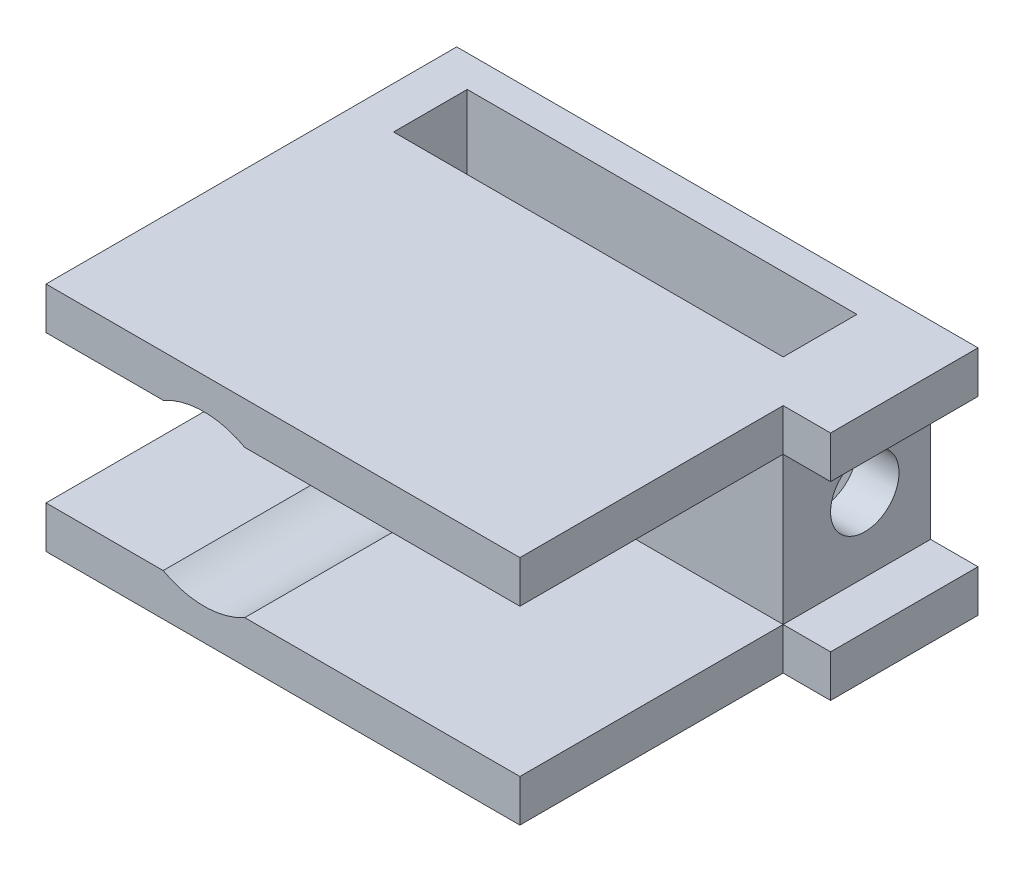
from build123d import *

# Parameters (mm, degrees)
ESQUISSE1_W                         = 45
ESQUISSE1_H                         = 22
BOSS_EXTRU_1_DEPTH                  = 4
ESQUISSE2_R                         = 6.4
ENL_V_MAT_EXTRU_1_DEPTH             = 4
FILETAGE1_PITCH                     = 1.4
ESQUISSE3_W                         = 4
ESQUISSE3_H                         = 22
BOSS_EXTRU_2_DEPTH                  = 10
ESQUISSE4_W                         = 3
ESQUISSE4_H                         = 22
BOSS_EXTRU_3_DEPTH                  = 37
ENL_V_MAT_EXTRU_2_REACH             = 49.592
ESQUISSE5_R                         = 3.25
ENL_V_MAT_EXTRU_2_DIRECTION_2_REACH = 49.592
ESQUISSE6_W                         = 45
ESQUISSE6_H                         = 4
BOSS_EXTRU_4_DEPTH                  = 25
ESQUISSE7_R                         = 8
ENL_V_MAT_EXTRU_4_DEPTH             = 25
ESQUISSE8_W                         = 14
ESQUISSE8_H                         = 4
BOSS_EXTRU_5_DEPTH                  = 4.5


with BuildPart() as part:
    # Esquisse1 → Boss.-Extru.1 (new body)
    with BuildSketch(Plane.XY):
        with Locations((22.5, -11)):
            Rectangle(ESQUISSE1_W, ESQUISSE1_H)
    extrude(amount=BOSS_EXTRU_1_DEPTH)

    # Esquisse2 → Enlèv. mat.-Extru.1 (cut)
    with BuildSketch(Plane(origin=(0, 0, 0), x_dir=(-1, 0, 0), z_dir=(0, 0, -1))):
        with Locations((-15, -11)):
            Circle(ESQUISSE2_R)
    extrude(amount=-ENL_V_MAT_EXTRU_1_DEPTH, mode=Mode.SUBTRACT)

    # Filetage1: the profile of Profil de filetage1 profile screwed along a right-hand helix of 4 turns, 8 arcs to a turn; built about Z, then put on its axis
    filetage1_z = Axis((0, 0, 0), (0, 0, 1))
    filetage1_corners = [(6.3997, 0, -0.000173205), (7.211898812, 0, 0.468749998), (7.211898812, 0, 0.656249998), (6.3997, 0, 1.125173201)]
    with BuildLine(mode=Mode.PRIVATE) as filetage1_profile:
        Line(filetage1_corners[0], filetage1_corners[1])
        Line(filetage1_corners[1], filetage1_corners[2])
        Line(filetage1_corners[2], filetage1_corners[3])
        Line(filetage1_corners[3], filetage1_corners[0])
    filetage1_cap = Face(filetage1_profile.wire())
    filetage1_turn_angles = [0, 22.5, 45, 67.5, 90, 112.5, 135, 157.5, 180, 202.5, 225, 247.5, 270, 292.5, 315, 337.5, 360]
    filetage1_turn_weights = [1, 0.9238795325112867, 1, 0.9238795325112867, 1, 0.9238795325112867, 1, 0.9238795325112867, 1, 0.9238795325112867, 1, 0.9238795325112867, 1, 0.9238795325112867, 1, 0.9238795325112867, 1]
    filetage1_turn_rails = [Edge.make_bspline([Vector(p[0], p[1], 0).rotate(filetage1_z, filetage1_turn_angles[k]) / filetage1_turn_weights[k] + Vector(0, 0, p[2] + FILETAGE1_PITCH * filetage1_turn_angles[k] / 360) for k in range(17)], [0, 0, 0, 1, 1, 2, 2, 3, 3, 4, 4, 5, 5, 6, 6, 7, 7, 8, 8, 8], 2, filetage1_turn_weights) for p in filetage1_corners]
    filetage1_turn_sides = [Face.make_surface_from_curves(filetage1_turn_rails[p[0]], filetage1_turn_rails[p[1]]) for p in [(0, 1), (1, 2), (2, 3), (3, 0)]]
    filetage1 = Plane(origin=(15, -11, -1), x_dir=(1, 0, 0), z_dir=(0, 0, 1)) * Solid(Shell([*[p.moved(Location((0, 0, FILETAGE1_PITCH * i))) for i in range(4) for p in filetage1_turn_sides], filetage1_cap, filetage1_cap.rotate(filetage1_z, 1440).moved(Location((0, 0, FILETAGE1_PITCH * 1440 / 360)))]))
    add(filetage1, mode=Mode.SUBTRACT)

    # Esquisse3 → Boss.-Extru.2 (add)
    with BuildSketch(Plane(origin=(0, 0, 0), x_dir=(-1, 0, 0), z_dir=(0, 0, -1))):
        with Locations((-43, -11)):
            Rectangle(ESQUISSE3_W, ESQUISSE3_H)
        with Locations((-2, -11)):
            Rectangle(ESQUISSE3_W, ESQUISSE3_H)
    extrude(amount=BOSS_EXTRU_2_DEPTH)

    # Esquisse4 → Boss.-Extru.3 (add)
    with BuildSketch(Plane(origin=(4, 0, 0), x_dir=(0, 0, -1), z_dir=(1, 0, 0))):
        with Locations((8.5, -11)):
            Rectangle(ESQUISSE4_W, ESQUISSE4_H)
    extrude(amount=BOSS_EXTRU_3_DEPTH)

    # Enlèv. mat.-Extru.2: up to this face of the body (flat: up to its plane)
    enl_v_mat_extru_2_end = Plane(part.part.faces().sort_by_distance((0, -11, -3))[0])
    # Esquisse5 → Enlèv. mat.-Extru.2 (cut, up to the picked face)
    with BuildSketch(Plane(origin=(4, 0, 0), x_dir=(0, 0, -1), z_dir=(1, 0, 0)), mode=Mode.PRIVATE) as enl_v_mat_extru_2_sk1:
        with Locations(Location((3.75, -11, 0), (0, 0, 180))):
            Circle(ESQUISSE5_R)
    enl_v_mat_extru_2_tool1 = split(extrude(enl_v_mat_extru_2_sk1.sketch, amount=-ENL_V_MAT_EXTRU_2_REACH, mode=Mode.PRIVATE), bisect_by=enl_v_mat_extru_2_end, keep=Keep.BOTH, mode=Mode.PRIVATE)
    add(enl_v_mat_extru_2_tool1.solids().sort_by(Axis((4, -11, -3.75), (-1, 0, 0)))[0], mode=Mode.SUBTRACT)

    # Enlèv. mat.-Extru.2 direction 2: up to this face of the body (flat: up to its plane)
    enl_v_mat_extru_2_direction_2_end = Plane(part.part.faces().sort_by_distance((45, -11, -3))[0])
    # Esquisse5 → Enlèv. mat.-Extru.2 direction 2 (cut, up to the picked face)
    with BuildSketch(Plane(origin=(4, 0, 0), x_dir=(0, 0, -1), z_dir=(1, 0, 0)), mode=Mode.PRIVATE) as enl_v_mat_extru_2_direction_2_sk1:
        with Locations(Location((3.75, -11, 0), (0, 0, 180))):
            Circle(ESQUISSE5_R)
    enl_v_mat_extru_2_direction_2_tool1 = split(extrude(enl_v_mat_extru_2_direction_2_sk1.sketch, amount=ENL_V_MAT_EXTRU_2_DIRECTION_2_REACH, mode=Mode.PRIVATE), bisect_by=enl_v_mat_extru_2_direction_2_end, keep=Keep.BOTH, mode=Mode.PRIVATE)
    add(enl_v_mat_extru_2_direction_2_tool1.solids().sort_by(Axis((4, -11, -3.75), (1, 0, 0)))[0], mode=Mode.SUBTRACT)

    # Esquisse6 → Boss.-Extru.4 (add)
    with BuildSketch(Plane.XY.offset(4)):
        with Locations((22.5, -2)):
            Rectangle(ESQUISSE6_W, ESQUISSE6_H)
        with Locations((22.5, -20)):
            Rectangle(ESQUISSE6_W, ESQUISSE6_H)
    extrude(amount=BOSS_EXTRU_4_DEPTH)

    # Esquisse7 → Enlèv. mat.-Extru.4 (cut)
    with BuildSketch(Plane.XY.offset(4)):
        with Locations((15, -11)):
            Circle(ESQUISSE7_R)
    extrude(amount=ENL_V_MAT_EXTRU_4_DEPTH, mode=Mode.SUBTRACT)

    # Esquisse8 → Boss.-Extru.5 (add)
    with BuildSketch(Plane(origin=(45, 0, 0), x_dir=(0, 0, -1), z_dir=(1, 0, 0))):
        with Locations((3, -20)):
            Rectangle(ESQUISSE8_W, ESQUISSE8_H)
        with Locations((3, -2)):
            Rectangle(ESQUISSE8_W, ESQUISSE8_H)
    extrude(amount=BOSS_EXTRU_5_DEPTH)


solid = part.part
